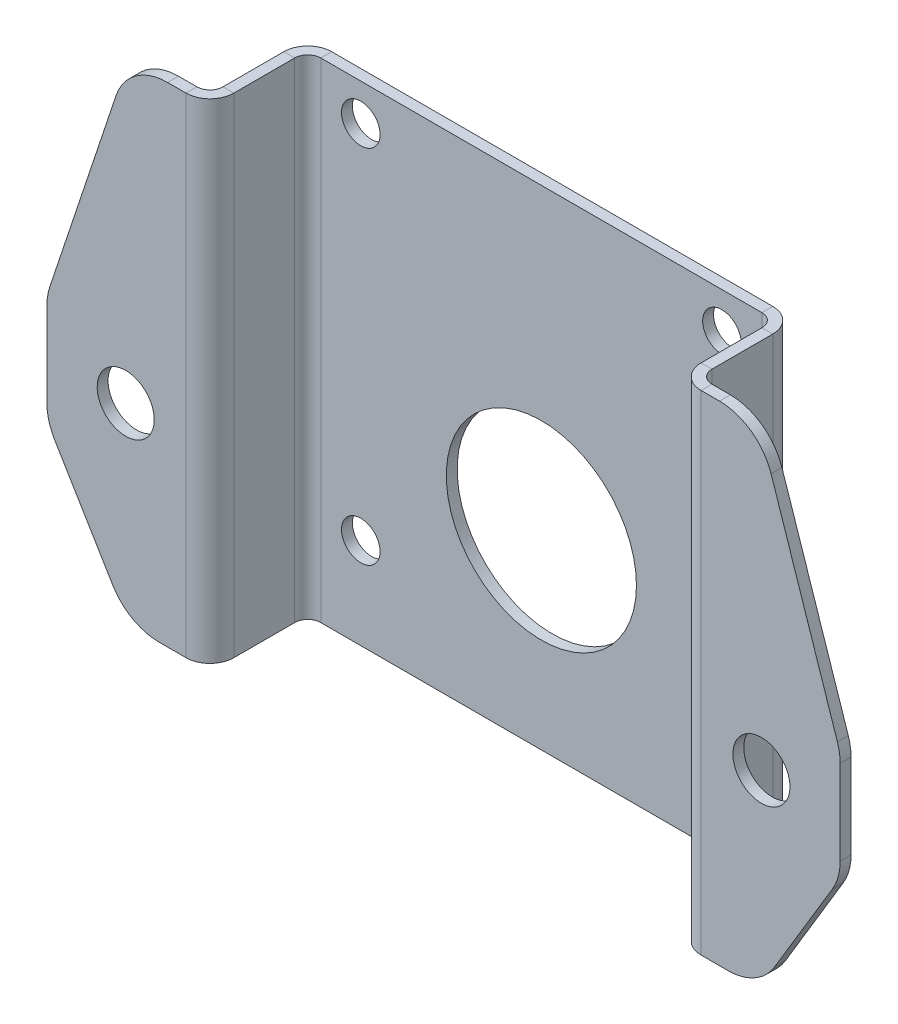
from build123d import *

# Parameters (mm, degrees)
SM_START                           = -40.6
SM_BASE_FLANGE_1_OUTLINE_W         = 2
SM_BASE_FLANGE_1_OUTLINE_H         = 90
SM_BASE_FLANGE_1_DEPTH             = 81.2
SKETCH_6_R                         = 17.5
CUT_EXTRUDE_1_DEPTH                = 10
F_7_1_7_1_DIAMETER_HOLE1_D         = 7.1
SM_EDGE_FLANGE_1_DEPTH             = 90
SM_EDGE_FLANGE_1_BEND_DEPTH        = 90
SM_EDGE_FLANGE_2_STRIP_W           = 12.8
SM_EDGE_FLANGE_2_STRIP_H           = 2
SM_EDGE_FLANGE_2_STRIP_CUT_DEPTH   = 90
SM_EDGE_FLANGE_2_STRIP_2_W         = 12.8
SM_EDGE_FLANGE_2_STRIP_2_H         = 2
SM_EDGE_FLANGE_2_STRIP_CUT_2_DEPTH = 90
SM_EDGE_FLANGE_2_DEPTH             = 90
SM_EDGE_FLANGE_2_BEND_DEPTH        = 90
CUT_EXTRUDE1_DEPTH                 = 118.273185341
FILLET_2_R                         = 10
F_10_5_10_5_DIAMETER_HOLE1_D       = 10.5


# Read off the part's stored shape, not the designer's step: Базовая кромка1
# Sheet-metal steps are written as plain solids
with BuildPart() as part:
    # Базовая кромка1 outline → Базовая кромка1 (new body)
    with BuildSketch(Plane(origin=(0, 0, 0), x_dir=(0, 0, -1), z_dir=(1, 0, 0)).offset(SM_START)):
        with Locations((1, 45)):
            Rectangle(SM_BASE_FLANGE_1_OUTLINE_W, SM_BASE_FLANGE_1_OUTLINE_H)
    extrude(amount=SM_BASE_FLANGE_1_DEPTH)

    # Эскиз6 → Вырез-Вытянуть1 (cut)
    with BuildSketch(Plane.XY):
        with Locations((0, 35)):
            Circle(SKETCH_6_R)
    extrude(amount=-CUT_EXTRUDE_1_DEPTH, mode=Mode.SUBTRACT)

    # Ø7.1 (7.1) Diameter Hole1 (through all)
    with Locations(Plane.XY):
        with Locations((-33.234018716, 83.234018716), (33.234018716, 83.234018716), (33.234018716, 16.765981284), (-33.234018716, 16.765981284)):
            Hole(F_7_1_7_1_DIAMETER_HOLE1_D / 2)

    # Ребро-кромка1 section (across the edge) → Ребро-кромка1 (add)
    with BuildSketch(Plane(origin=(43, 0, 0), x_dir=(-1, 0, 0), z_dir=(0, 1, 0))):
        with BuildLine():
            Line((-2, 2.4), (-2, 18))
            Line((-2, 18), (0, 18))
            Line((0, 18), (0, 2.4))
            ThreePointArc((0, 2.4), (0.702943725, 0.702943725), (2.4, 0))
            Line((2.4, 0), (2.4, -2))
            ThreePointArc((2.4, -2), (-0.711269837, -0.711269837), (-2, 2.4))
        make_face()
    extrude(amount=SM_EDGE_FLANGE_1_DEPTH)

    # Ребро-кромка1 section 2 (across the edge) → Ребро-кромка1 bend (add)
    with BuildSketch(Plane(origin=(-43, 90, 0), x_dir=(1, 0, 0), z_dir=(0, -1, 0))):
        with BuildLine():
            Line((-2, 2.4), (-2, 18))
            Line((-2, 18), (0, 18))
            Line((0, 18), (0, 2.4))
            ThreePointArc((0, 2.4), (0.702943725, 0.702943725), (2.4, 0))
            Line((2.4, 0), (2.4, -2))
            ThreePointArc((2.4, -2), (-0.711269837, -0.711269837), (-2, 2.4))
        make_face()
    extrude(amount=SM_EDGE_FLANGE_1_BEND_DEPTH)

    # Ребро-кромка2 strip (across the edge) → Ребро-кромка2 strip cut (cut)
    with BuildSketch(Plane(origin=(45, 90, 18), x_dir=(0, 0, -1), z_dir=(0, -1, 0))):
        with Locations((-2, -1)):
            Rectangle(SM_EDGE_FLANGE_2_STRIP_W, SM_EDGE_FLANGE_2_STRIP_H)
    extrude(amount=SM_EDGE_FLANGE_2_STRIP_CUT_DEPTH, mode=Mode.SUBTRACT)

    # Ребро-кромка2 strip 2 (across the edge) → Ребро-кромка2 strip cut 2 (cut)
    with BuildSketch(Plane(origin=(-45, 0, 18), x_dir=(0, 0, -1), z_dir=(0, 1, 0))):
        with Locations((-2, -1)):
            Rectangle(SM_EDGE_FLANGE_2_STRIP_2_W, SM_EDGE_FLANGE_2_STRIP_2_H)
    extrude(amount=SM_EDGE_FLANGE_2_STRIP_CUT_2_DEPTH, mode=Mode.SUBTRACT)

    # Ребро-кромка2 section (across the edge) → Ребро-кромка2 (add)
    with BuildSketch(Plane(origin=(45, 90, 18), x_dir=(0, 0, -1), z_dir=(0, -1, 0))):
        with BuildLine():
            Line((0, 2.4), (0, 28))
            Line((0, 28), (2, 28))
            Line((2, 28), (2, 2.4))
            ThreePointArc((2, 2.4), (2.702943725, 0.702943725), (4.4, 0))
            Line((4.4, 0), (4.4, -2))
            ThreePointArc((4.4, -2), (1.288730163, -0.711269837), (0, 2.4))
        make_face()
    extrude(amount=SM_EDGE_FLANGE_2_DEPTH)

    # Ребро-кромка2 section 2 (across the edge) → Ребро-кромка2 bend (add)
    with BuildSketch(Plane(origin=(-45, 0, 18), x_dir=(0, 0, -1), z_dir=(0, 1, 0))):
        with BuildLine():
            Line((0, 2.4), (0, 28))
            Line((0, 28), (2, 28))
            Line((2, 28), (2, 2.4))
            ThreePointArc((2, 2.4), (2.702943725, 0.702943725), (4.4, 0))
            Line((4.4, 0), (4.4, -2))
            ThreePointArc((4.4, -2), (1.288730163, -0.711269837), (0, 2.4))
        make_face()
    extrude(amount=SM_EDGE_FLANGE_2_BEND_DEPTH)

    # Sketch4 → Cut-Extrude1 (cut, through all)
    with BuildSketch(Plane(origin=(0, 0, 16), x_dir=(-1, 0, 0), z_dir=(0, 0, -1))):
        Polygon((-73, 90), (-58, 90), (-73, 45), align=None)
        Polygon((-73, 25), (-58, 0), (-73, 0), align=None)
        Polygon((73, 0), (73, 25), (58, 0), align=None)
        Polygon((58, 90), (73, 45), (73, 90), align=None)
    extrude(amount=-CUT_EXTRUDE1_DEPTH, mode=Mode.SUBTRACT)

    # Скругление2
    fillet_2_edges = [part.edges().sort_by_distance(p)[0] for p in [
        (-58, 90, 17),
        (-73, 45, 17),
        (-58, 0, 17),
        (-73, 25, 17),
        (73, 25, 17),
        (58, 0, 17),
        (73, 45, 17),
        (58, 90, 17),
    ]]
    fillet(fillet_2_edges, radius=FILLET_2_R)

    # Ø10.5 (10.5) Diameter Hole1 (through all)
    with Locations(Plane(origin=(0, 0, -2), x_dir=(-1, 0, 0), z_dir=(0, 0, -1))):
        with Locations((-58.5, 35), (58.5, 35)):
            Hole(F_10_5_10_5_DIAMETER_HOLE1_D / 2)


solid = part.part
